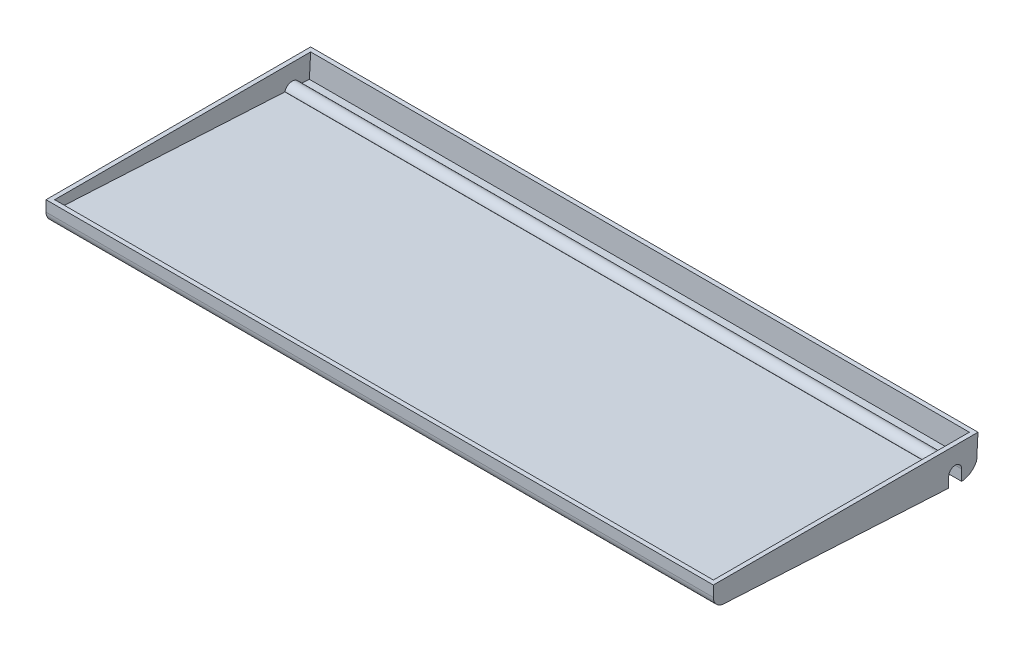
from build123d import *

# Parameters (mm, degrees)
SALIENTE_EXTRUIR1_DEPTH     = 310.007
CORTAR_EXTRUIR1_START       = 0.474917769
CORTAR_EXTRUIR1_OUTLINE_W   = 313
CORTAR_EXTRUIR1_OUTLINE_H   = 2.059275456
CORTAR_EXTRUIR1_OUTLINE_W_2 = 305.9938
CORTAR_EXTRUIR1_OUTLINE_H_2 = 118.74613036
CORTAR_EXTRUIR1_DEPTH       = 10.863473519
CORTAR_EXTRUIR2_DEPTH       = 317.143434336
SALIENTE_EXTRUIR2_REACH     = 316.176


# Read off the part's stored shape, not the designer's step: Cortar-Extruir1
with BuildPart() as part:
    # Croquis1 → Saliente-Extruir1 (new body)
    with BuildSketch(Plane(origin=(0, 0, 0), x_dir=(0, 0, -1), z_dir=(1, 0, 0))):
        with BuildLine():
            Line((-61.468, 8.001), (61.468, 8.001))
            Line((61.468, 8.001), (61.468, 0))
            ThreePointArc((61.468, 0), (58.968267477, -5.809652067), (53.031040334, -7.989113854))
            Line((53.031040334, -7.989113854), (-56.736847791, -1.999166442))
            ThreePointArc((-56.736847791, -1.999166442), (-60.09753796, -0.443275216), (-61.468, 2.9972))
            Line((-61.468, 2.9972), (-61.468, 8.001))
        make_face()
    extrude(amount=SALIENTE_EXTRUIR1_DEPTH)

    # Cortar-Extruir1 outline → Cortar-Extruir1 (cut)
    with BuildSketch(Plane(origin=(0, 0, 0), x_dir=(1, 0, 0), z_dir=(0, 0.9985144174273646, -0.054488147240394726)).offset(CORTAR_EXTRUIR1_START)):
        with Locations((155.5, 61.970362272)):
            Rectangle(CORTAR_EXTRUIR1_OUTLINE_W, CORTAR_EXTRUIR1_OUTLINE_H)
        with Locations((155.0035, -0.435959666)):
            Rectangle(CORTAR_EXTRUIR1_OUTLINE_W_2, CORTAR_EXTRUIR1_OUTLINE_H_2)
    extrude(amount=CORTAR_EXTRUIR1_DEPTH, mode=Mode.SUBTRACT)

    # Croquis3 → Cortar-Extruir2 (cut, through all)
    with BuildSketch(Plane(origin=(310.007, 0, 0), x_dir=(0, 0, -1), z_dir=(1, 0, 0))):
        with BuildLine():
            Line((47.871269455, -2.985313854), (47.871269455, -7.707549211))
            Line((47.871269455, -7.707549211), (53.031040334, -7.989113854))
            ThreePointArc((53.031040334, -7.989113854), (53.448329481, -8.000978216), (53.865669455, -7.991061486))
            Line((53.865669455, -7.991061486), (53.865669455, -2.985313854))
            ThreePointArc((53.865669455, -2.985313854), (50.868469455, 0.011886146), (47.871269455, -2.985313854))
        make_face()
    extrude(amount=-CORTAR_EXTRUIR2_DEPTH, mode=Mode.SUBTRACT)

    # Croquis4 → Saliente-Extruir2 (add, up to next)
    with BuildSketch(Plane.ZY.offset(-308.0004), mode=Mode.PRIVATE) as saliente_extruir2_sk1:
        with BuildLine():
            ThreePointArc((-54.319674223, -2.372441361), (-54.323209583, -2.4306924), (-54.313356663, -2.488212852))
            Line((-54.313356663, -2.488212852), (-53.819499619, -2.461263461))
            ThreePointArc((-53.819499619, -2.461263461), (-51.03178133, 0.007433558), (-47.991986492, -2.143260648))
            Line((-47.991986492, -2.143260648), (-47.498129447, -2.116311258))
            ThreePointArc((-47.498129447, -2.116311258), (-47.494594087, -2.058060218), (-47.504447006, -2.000539766))
            ThreePointArc((-47.504447006, -2.000539766), (-51.059461309, 0.514678882), (-54.319674223, -2.372441361))
        make_face()
    saliente_extruir2_tool1 = extrude(saliente_extruir2_sk1.sketch, amount=SALIENTE_EXTRUIR2_REACH, mode=Mode.PRIVATE) - part.part
    add(saliente_extruir2_tool1.solids().sort_by_distance((308.0004, 0.440165, -51.055395))[0])


solid = part.part
